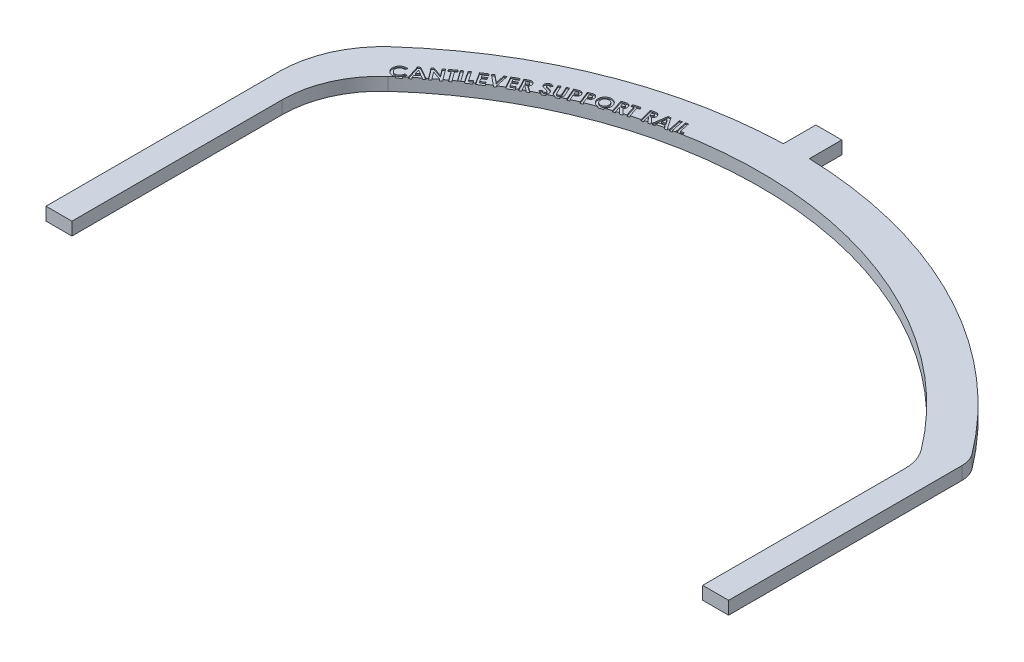
from build123d import *

# Parameters (mm, degrees)
BOSS_EXTRUDE1_DEPTH = 12.7
CUT_EXTRUDE1_DEPTH  = 1.27


with BuildPart() as part:
    # Sketch1 → Boss-Extrude1 (new body)
    with BuildSketch(Plane(origin=(0, 0, 0), x_dir=(1, 0, 0), z_dir=(0, 1, 0))):
        with BuildLine():
            Line((1819.575647687, 435.422089048), (1819.575647687, 467.172089048))
            Line((1819.575647687, 467.172089048), (1844.975647687, 467.172089048))
            Line((1844.975647687, 467.172089048), (1844.975647687, 435.422089048))
            ThreePointArc((1844.975647687, 435.422089048), (2029.473013653, 387.633813525), (2175.09792673, 264.685116838))
            ThreePointArc((2175.09792673, 264.685116838), (2178.788123296, 257.671206838), (2180.062077689, 249.848833516))
            Line((2180.062077689, 249.848833516), (2180.062077689, 21.248833516))
            Line((2180.062077689, 21.248833516), (2154.662077689, 21.248833516))
            Line((2154.662077689, 21.248833516), (2154.662077689, 219.483794294))
            ThreePointArc((2154.662077689, 219.483794294), (2152.61836445, 232.032664182), (2146.698447993, 243.284574615))
            ThreePointArc((2146.698447993, 243.284574615), (1870.010120454, 398.237483297), (1568.838927964, 298.92611779))
            ThreePointArc((1568.838927964, 298.92611779), (1545.192529126, 266.379641947), (1536.828313208, 227.029099893))
            Line((1536.828313208, 227.029099893), (1536.828313208, 21.248833516))
            Line((1536.828313208, 21.248833516), (1511.428313208, 21.248833516))
            Line((1511.428313208, 21.248833516), (1511.428313208, 249.848833516))
            ThreePointArc((1511.428313208, 249.848833516), (1520.212094711, 291.173276452), (1545.044643602, 325.352347784))
            ThreePointArc((1545.044643602, 325.352347784), (1672.530573308, 404.778988418), (1819.575647687, 435.422089048))
        make_face()
    extrude(amount=BOSS_EXTRUDE1_DEPTH)

    # Sketch2 → Cut-Extrude1 (cut)
    # profile 1 of 21: a face of its own
    with BuildSketch(Plane(origin=(0, 12.7, 0), x_dir=(1, 0, 0), z_dir=(0, 1, 0))):
        with BuildLine():
            Line((1571.843475239, 315.241241989), (1571.624685175, 312.938858175))
            add(Edge.make_bspline(
                [(1571.624685175, 312.938858175), (1571.423830346, 312.95320018), (1571.030817247, 312.981263212), (1570.451460835, 312.966511255), (1569.89853054, 312.897766329), (1569.37223433, 312.778767812), (1568.872957947, 312.607797373), (1568.400961983, 312.384647821), (1567.955361244, 312.109537243), (1567.683392705, 311.889488783), (1567.546540143, 311.778762021)],
                knots=[0, 0, 0, 0, 1.106976668, 2.166023744, 3.181239144, 4.166665488, 5.128286044, 6.077510706, 7.032617573, 8, 8, 8, 8], degree=3))
            add(Edge.make_bspline(
                [(1567.546540143, 311.778762021), (1567.437597095, 311.679954033), (1567.222628045, 311.48498373), (1566.941035406, 311.160460329), (1566.697436094, 310.819246434), (1566.489171518, 310.462744752), (1566.324292505, 310.086543291), (1566.195349674, 309.693979337), (1566.107364091, 309.283744628), (1566.056539564, 308.861339139), (1566.046347193, 308.436210992), (1566.076400875, 308.017758642), (1566.147663052, 307.611011022), (1566.260724163, 307.216442504), (1566.413731149, 306.833467742), (1566.608761863, 306.463165076), (1566.843614303, 306.104082164), (1567.027885726, 305.880783175), (1567.121680368, 305.767123399)],
                knots=[0, 0, 0, 0, 1.049434135, 2.070768733, 3.060452324, 4.039838748, 5.013084992, 5.987742953, 6.985396685, 8.003837291, 9.021395483, 10.017099485, 10.994687286, 11.964499222, 12.942743154, 13.934036996, 14.948419371, 16, 16, 16, 16], degree=3))
            add(Edge.make_bspline(
                [(1567.121680368, 305.767123399), (1567.190008672, 305.689640222), (1567.325023071, 305.536536105), (1567.546307933, 305.329608036), (1567.769343702, 305.13573185), (1567.998395719, 304.957570602), (1568.239162335, 304.804651982), (1568.482455302, 304.66206386), (1568.73653994, 304.543714983), (1569.078939899, 304.404505617), (1569.521212625, 304.278677222), (1570.064589098, 304.208210305), (1570.61567632, 304.210675395), (1571.076208289, 304.276072347), (1571.44105165, 304.367936278), (1571.712465721, 304.450339398), (1571.975738465, 304.556973188), (1572.233996588, 304.678316129), (1572.486954395, 304.815768988), (1572.732723891, 304.971963537), (1572.971180863, 305.147724596), (1573.124611751, 305.275343225), (1573.202008893, 305.339719553)],
                knots=[0, 0, 0, 0, 0.906769888, 1.791746381, 2.657716153, 3.502317473, 4.336877027, 5.160868724, 5.977048615, 6.795772978, 8.405980936, 9.998576458, 11.592373078, 13.232275799, 14.068594734, 14.895408789, 15.721048034, 16.560610452, 17.400470113, 18.247563275, 19.115995509, 20, 20, 20, 20], degree=3))
            add(Edge.make_bspline(
                [(1573.202008893, 305.339719553), (1573.327394408, 305.455172782), (1573.573638056, 305.681910489), (1573.896190837, 306.058479393), (1574.166856093, 306.457715982), (1574.355442981, 306.809709288), (1574.480169921, 307.108860132), (1574.567494245, 307.351244823), (1574.642970862, 307.613161328), (1574.708386674, 307.893660828), (1574.766687905, 308.191547501), (1574.817802581, 308.507042123), (1574.85877398, 308.841402876), (1574.876879352, 309.0709405), (1574.886183573, 309.188898239)],
                knots=[0, 0, 0, 0, 1.416413735, 2.781684042, 4.111660732, 5.420779439, 6.093942959, 6.805459672, 7.561959237, 8.35901249, 9.199844318, 10.085547768, 11.016176728, 12, 12, 12, 12], degree=3))
            Line((1574.886183573, 309.188898239), (1577.216552163, 308.977740387))
            add(Edge.make_bspline(
                [(1577.216552163, 308.977740387), (1577.202738534, 308.819844327), (1577.175794321, 308.511859698), (1577.111963056, 308.062705702), (1577.04320757, 307.635185437), (1576.956736694, 307.230134681), (1576.854809766, 306.848313285), (1576.740682876, 306.488998652), (1576.613917814, 306.152387988), (1576.471994882, 305.835978447), (1576.316301242, 305.532760174), (1576.138768716, 305.238961989), (1575.943046876, 304.949738664), (1575.729854522, 304.664662461), (1575.496112608, 304.386262393), (1575.245572176, 304.111361864), (1574.971684774, 303.844456554), (1574.779924283, 303.67185785), (1574.682657932, 303.584310899)],
                knots=[0, 0, 0, 0, 1.238676233, 2.416103621, 3.545066288, 4.62283798, 5.651870757, 6.632945802, 7.568586176, 8.461700084, 9.34220446, 10.231176254, 11.143058229, 12.071059825, 13.012271904, 13.9834215, 14.97713428, 16, 16, 16, 16], degree=3))
            add(Edge.make_bspline(
                [(1574.682657932, 303.584310899), (1574.498657569, 303.431711082), (1574.138593606, 303.133093763), (1573.56444995, 302.749633157), (1572.977890605, 302.431884322), (1572.37665404, 302.181374823), (1571.763450623, 301.993672095), (1571.135717829, 301.873131331), (1570.495330704, 301.821105896), (1569.84754268, 301.830338006), (1569.205957145, 301.907014987), (1568.579314288, 302.043431872), (1567.977191287, 302.24914531), (1567.396796017, 302.515090326), (1566.837706583, 302.843074573), (1566.304134329, 303.236977706), (1565.79056662, 303.691963694), (1565.47770405, 304.034982613), (1565.317934374, 304.210152246)],
                knots=[0, 0, 0, 0, 1.089001882, 2.13103023, 3.141022524, 4.125189271, 5.094826855, 6.059095141, 7.032676967, 8.018451583, 9.007063902, 9.973019583, 10.936218174, 11.901346006, 12.878496912, 13.885081116, 14.919973381, 16, 16, 16, 16], degree=3))
            add(Edge.make_bspline(
                [(1565.317934374, 304.210152246), (1565.219225606, 304.328772834), (1565.024271801, 304.56305329), (1564.75554874, 304.927248485), (1564.518438792, 305.301410187), (1564.313582927, 305.684657582), (1564.129642395, 306.071791752), (1563.981243258, 306.469160166), (1563.857621378, 306.873317043), (1563.763682707, 307.283919991), (1563.700465758, 307.699823901), (1563.664762958, 308.117963515), (1563.656627576, 308.53786684), (1563.679258169, 308.958846411), (1563.735185789, 309.380639705), (1563.8121497, 309.805291307), (1563.922366832, 310.231068134), (1564.062980725, 310.654293086), (1564.226299965, 311.07111694), (1564.414978274, 311.475218067), (1564.629619394, 311.861973795), (1564.866303811, 312.234957115), (1565.128370115, 312.590927953), (1565.414969291, 312.929788063), (1565.722493723, 313.255398592), (1565.945723507, 313.455959724), (1566.058258893, 313.55706731)],
                knots=[0, 0, 0, 0, 1.061484739, 2.096475253, 3.111275369, 4.105800305, 5.08452608, 6.057532138, 7.02088866, 7.990320313, 8.952368766, 9.912611286, 10.875367024, 11.839394567, 12.80975613, 13.800664069, 14.806706453, 15.832448127, 16.867043958, 17.884891479, 18.898046889, 19.907921701, 20.921899798, 21.9362806, 22.95963049, 24, 24, 24, 24], degree=3))
            add(Edge.make_bspline(
                [(1566.058258893, 313.55706731), (1566.156358177, 313.640739803), (1566.351932561, 313.8075524), (1566.664891763, 314.032172309), (1566.98472784, 314.244281066), (1567.315450514, 314.438110352), (1567.657498585, 314.611109041), (1568.010296888, 314.766296078), (1568.372830605, 314.907298962), (1568.746622874, 315.024694527), (1569.125214549, 315.128797988), (1569.509147497, 315.205009785), (1569.893175331, 315.268140341), (1570.279784311, 315.30631184), (1570.667998187, 315.320865497), (1571.058567937, 315.315632115), (1571.451020389, 315.291076997), (1571.712175279, 315.257914823), (1571.843475239, 315.241241989)],
                knots=[0, 0, 0, 0, 0.995486114, 1.984638165, 2.972922349, 3.959272787, 4.943533129, 5.931817313, 6.935373211, 7.946255676, 8.95677732, 9.966470711, 10.967951, 11.961884362, 12.964820168, 13.967071288, 14.97791131, 16, 16, 16, 16], degree=3))
        make_face()
    # profile 2 of 21: a face of its own
    with BuildSketch(Plane(origin=(0, 12.7, 0), x_dir=(1, 0, 0), z_dir=(0, 1, 0))):
        Polygon((1575.292876009, 321.065046146), (1577.190752611, 322.606752877), (1588.949446521, 315.852245665), (1587.00577665, 314.274921947), (1584.596541874, 315.674160729), (1580.589630816, 312.417750473), (1581.431718156, 309.746476434), (1579.488048284, 308.166608646), align=None)
        Polygon((1578.368657259, 319.243491659), (1579.803513028, 314.806632684), (1582.413729374, 316.928387492), align=None, mode=Mode.SUBTRACT)
    # profile 3 of 21: a face of its own
    with BuildSketch(Plane(origin=(0, 12.7, 0), x_dir=(1, 0, 0), z_dir=(0, 1, 0))):
        Polygon((1582.793735528, 327.041800799), (1584.625466297, 328.430863299), (1593.964749149, 325.090498716), (1588.940209887, 331.70762612), (1590.855894983, 333.160290383), (1598.490650592, 323.103579645), (1596.651287611, 321.706884934), (1587.337445463, 325.034529165), (1592.344176233, 318.437754325), (1590.428491137, 316.985090062), align=None)
    # profile 4 of 21: a face of its own
    with BuildSketch(Plane(origin=(0, 12.7, 0), x_dir=(1, 0, 0), z_dir=(0, 1, 0))):
        Polygon((1592.420131061, 334.381377998), (1598.108672727, 338.469699312), (1599.495191157, 336.538749793), (1597.620211189, 335.190392421), (1603.62676167, 326.830576716), (1601.639842599, 325.403353158), (1595.633292118, 333.763168863), (1593.80664949, 332.450428479), align=None)
    # profile 5 of 21: a face of its own
    with BuildSketch(Plane(origin=(0, 12.7, 0), x_dir=(1, 0, 0), z_dir=(0, 1, 0))):
        Polygon((1599.245875898, 339.283355994), (1601.192089841, 340.682594776), (1608.585158751, 330.391829552), (1606.638944809, 328.99259077), align=None)
    # profile 6 of 21: a face of its own
    with BuildSketch(Plane(origin=(0, 12.7, 0), x_dir=(1, 0, 0), z_dir=(0, 1, 0))):
        Polygon((1603.745716433, 342.371184824), (1605.747899927, 343.716998125), (1611.535660343, 335.102775369), (1614.456253292, 337.064253734), (1615.741008901, 335.153656779), (1610.818232459, 331.846365112), align=None)
    # profile 7 of 21: a face of its own
    with BuildSketch(Plane(origin=(0, 12.7, 0), x_dir=(1, 0, 0), z_dir=(0, 1, 0))):
        Polygon((1610.524721329, 346.818657423), (1616.33283431, 350.530456301), (1617.599781425, 348.548625372), (1613.801484149, 346.121582103), (1615.030270207, 344.198264795), (1618.828567483, 346.625308064), (1620.072617963, 344.679094122), (1616.274320688, 342.252050853), (1618.065346329, 339.451029218), (1621.863643605, 341.878072487), (1623.135678861, 339.888609346), (1617.32756588, 336.176810468), align=None)
    # profile 8 of 21: a face of its own
    with BuildSketch(Plane(origin=(0, 12.7, 0), x_dir=(1, 0, 0), z_dir=(0, 1, 0))):
        Polygon((1617.701411816, 351.316695569), (1619.8079022, 352.588730825), (1627.124648995, 346.577092203), (1625.257301239, 355.875669928), (1627.363791623, 357.145161114), (1629.97655204, 344.048286114), (1628.002353322, 342.857661114), align=None)
    # profile 9 of 21: a face of its own
    with BuildSketch(Plane(origin=(0, 12.7, 0), x_dir=(1, 0, 0), z_dir=(0, 1, 0))):
        Polygon((1629.423534241, 358.40580891), (1635.42499658, 361.799598974), (1636.582548664, 359.751622211), (1632.659591933, 357.533192724), (1633.7840711, 355.546273653), (1637.70702783, 357.764703141), (1638.84422735, 355.754887435), (1634.921270619, 353.536457948), (1636.557107959, 350.643849775), (1640.480064689, 352.862279262), (1641.642704914, 350.806670288), (1635.641242574, 347.412880224), align=None)
    # profile 10 of 21: a face of its own
    with BuildSketch(Plane(origin=(0, 12.7, 0), x_dir=(1, 0, 0), z_dir=(0, 1, 0))):
        with BuildLine():
            Line((1637.793764322, 363.052792386), (1640.037634514, 364.251049597))
            add(Edge.make_bspline(
                [(1640.037634514, 364.251049597), (1640.186667462, 364.328633943), (1640.47328419, 364.477842367), (1640.890341997, 364.686498318), (1641.28231965, 364.861277099), (1641.645882783, 365.010273517), (1641.98245437, 365.129482092), (1642.290270996, 365.22671458), (1642.572100657, 365.290475744), (1642.908816123, 365.338899967), (1643.311042174, 365.345296652), (1643.782360817, 365.275248714), (1644.242890429, 365.13028643), (1644.611481026, 364.949625337), (1644.896537931, 364.77252971), (1645.103396517, 364.620392618), (1645.295452221, 364.447335936), (1645.484408767, 364.264865346), (1645.657883573, 364.060235026), (1645.824930181, 363.841738097), (1645.976751463, 363.603553759), (1646.070398227, 363.437390104), (1646.11796304, 363.352992706)],
                knots=[0, 0, 0, 0, 1.424492194, 2.739550529, 3.952795884, 5.062248034, 6.06963158, 6.979329466, 7.797359636, 8.516206473, 9.860824738, 11.190754886, 12.539192688, 13.937924531, 14.658100404, 15.382819568, 16.111238118, 16.848403364, 17.607947602, 18.382986091, 19.178690634, 20, 20, 20, 20], degree=3))
            add(Edge.make_bspline(
                [(1646.11796304, 363.352992706), (1646.164245124, 363.262882078), (1646.255011784, 363.086160546), (1646.366065452, 362.814993718), (1646.45876299, 362.547928155), (1646.529174074, 362.282056374), (1646.570929722, 362.017646443), (1646.594219927, 361.755878358), (1646.598779797, 361.496941252), (1646.573183604, 361.240238507), (1646.532652091, 360.985687952), (1646.460575778, 360.734964919), (1646.373433096, 360.485519449), (1646.259081922, 360.239645992), (1646.12457543, 359.995242302), (1645.966299104, 359.754479723), (1645.787098865, 359.514832541), (1645.652680983, 359.362955422), (1645.583708232, 359.285023956)],
                knots=[0, 0, 0, 0, 1.099424827, 2.156150103, 3.178169677, 4.167481509, 5.137758016, 6.080559922, 7.019758177, 7.944218001, 8.878166263, 9.814109368, 10.772252545, 11.744580148, 12.754248578, 13.798749037, 14.870490064, 16, 16, 16, 16], degree=3))
            Line((1645.583708232, 359.285023956), (1650.849934194, 355.746221873))
            Line((1650.849934194, 355.746221873), (1648.537374097, 354.512347674))
            Line((1648.537374097, 354.512347674), (1643.525555187, 357.885785174))
            Line((1643.525555187, 357.885785174), (1643.327117687, 357.778934213))
            Line((1643.327117687, 357.778934213), (1645.840659354, 353.072403764))
            Line((1645.840659354, 353.072403764), (1643.726536758, 351.942836456))
            Line((1643.726536758, 351.942836456), (1637.793764322, 363.052792386))
        make_face()
        with BuildLine():
            Line((1642.228079226, 359.839631328), (1642.8946257, 360.1958012))
            add(Edge.make_bspline(
                [(1642.8946257, 360.1958012), (1642.975420472, 360.240322147), (1643.129836947, 360.325411412), (1643.347955088, 360.454297268), (1643.538911551, 360.584867186), (1643.707427965, 360.711740321), (1643.853109931, 360.835433203), (1643.974601947, 360.958417813), (1644.071435952, 361.079378737), (1644.167900054, 361.236373908), (1644.243885626, 361.445305905), (1644.252880455, 361.716453691), (1644.195300304, 362.002643575), (1644.10672378, 362.185232425), (1644.059809995, 362.28193902)],
                knots=[0, 0, 0, 0, 1.207273965, 2.307364512, 3.313912315, 4.232827562, 5.067016212, 5.812559251, 6.491981624, 7.089620791, 8.21986244, 9.353205492, 10.598148319, 12, 12, 12, 12], degree=3))
            add(Edge.make_bspline(
                [(1644.059809995, 362.28193902), (1644.025802573, 362.339836412), (1643.959747713, 362.452294337), (1643.835780978, 362.599744003), (1643.693549774, 362.721221809), (1643.535899466, 362.8168612), (1643.367790908, 362.890296416), (1643.189930978, 362.929401316), (1643.006677617, 362.946083103), (1642.848824886, 362.933764874), (1642.712568676, 362.911433447), (1642.596359504, 362.875683478), (1642.464173181, 362.83366135), (1642.31798053, 362.776914621), (1642.158960674, 362.704340321), (1641.982733075, 362.623499015), (1641.792539781, 362.529651065), (1641.662262165, 362.460380793), (1641.594605668, 362.424406969)],
                knots=[0, 0, 0, 0, 1.140030064, 2.21435567, 3.257366816, 4.305744609, 5.339347344, 6.360508158, 7.387757027, 8.457040643, 9.042480678, 9.73163295, 10.520357663, 11.401205891, 12.395136345, 13.49167456, 14.697362465, 16, 16, 16, 16], degree=3))
            Line((1641.594605668, 362.424406969), (1641.012013521, 362.114030367))
            Line((1641.012013521, 362.114030367), (1642.228079226, 359.839631328))
        make_face(mode=Mode.SUBTRACT)
    # profile 11 of 21: a face of its own
    with BuildSketch(Plane(origin=(0, 12.7, 0), x_dir=(1, 0, 0), z_dir=(0, 1, 0))):
        with BuildLine():
            Line((1658.175171156, 371.572727584), (1657.266937983, 369.382282873))
            add(Edge.make_bspline(
                [(1657.266937983, 369.382282873), (1657.153352587, 369.441821201), (1656.934970226, 369.556291205), (1656.606235965, 369.691192766), (1656.293899714, 369.789879794), (1655.998232566, 369.851518312), (1655.718821587, 369.880679324), (1655.456700581, 369.864140419), (1655.210221831, 369.815512586), (1655.059539365, 369.752068126), (1654.984906733, 369.720644251)],
                knots=[0, 0, 0, 0, 1.285296499, 2.471145873, 3.557662113, 4.56489411, 5.495608138, 6.364408464, 7.189895782, 8, 8, 8, 8], degree=3))
            add(Edge.make_bspline(
                [(1654.984906733, 369.720644251), (1654.918234434, 369.685525899), (1654.789568012, 369.617753333), (1654.624123568, 369.482995045), (1654.491978438, 369.328669007), (1654.396213132, 369.1586783), (1654.334419861, 368.985279977), (1654.310516617, 368.816665833), (1654.320311683, 368.654987509), (1654.359700127, 368.558145646), (1654.379417951, 368.509666687)],
                knots=[0, 0, 0, 0, 1.206288137, 2.32793501, 3.399041274, 4.446745914, 5.440434485, 6.332997129, 7.165499693, 8, 8, 8, 8], degree=3))
            add(Edge.make_bspline(
                [(1654.379417951, 368.509666687), (1654.404948204, 368.463631114), (1654.456197837, 368.371218937), (1654.56283673, 368.25166272), (1654.690281046, 368.147332659), (1654.787220204, 368.092704416), (1654.837350643, 368.064454347)],
                knots=[0, 0, 0, 0, 0.970103811, 1.94739414, 2.938529743, 4, 4, 4, 4], degree=3))
            add(Edge.make_bspline(
                [(1654.837350643, 368.064454347), (1654.880457446, 368.045456282), (1654.980065254, 368.001557049), (1655.154004261, 367.935954453), (1655.373142115, 367.862874497), (1655.637165953, 367.782175315), (1655.946256268, 367.69363072), (1656.299508999, 367.593860213), (1656.698307468, 367.487751451), (1656.979401869, 367.415498036), (1657.127014105, 367.377555309)],
                knots=[0, 0, 0, 0, 0.472459698, 1.091722678, 1.863730528, 2.789308553, 3.860756084, 5.088780154, 6.471219384, 8, 8, 8, 8], degree=3))
            add(Edge.make_bspline(
                [(1657.127014105, 367.377555309), (1657.265264183, 367.342874285), (1657.527401208, 367.277115333), (1657.899518678, 367.182333798), (1658.22989405, 367.099451835), (1658.517490864, 367.023462154), (1658.762207737, 366.954233703), (1658.965593665, 366.89531153), (1659.128550351, 366.849132513), (1659.221742663, 366.816509231), (1659.261489265, 366.802595373)],
                knots=[0, 0, 0, 0, 1.547130358, 2.933525647, 4.168111207, 5.244294024, 6.162246243, 6.928465324, 7.542989536, 8, 8, 8, 8], degree=3))
            add(Edge.make_bspline(
                [(1659.261489265, 366.802595373), (1659.416866543, 366.745759691), (1659.715167566, 366.636643722), (1660.128022974, 366.439385384), (1660.49289905, 366.229856242), (1660.808902176, 365.99701465), (1661.085421037, 365.741843236), (1661.329306474, 365.457900876), (1661.547567352, 365.144854733), (1661.666405432, 364.91634032), (1661.726693592, 364.800411879)],
                knots=[0, 0, 0, 0, 1.213962975, 2.330626473, 3.354589457, 4.298409828, 5.205929417, 6.110775893, 7.041571155, 8, 8, 8, 8], degree=3))
            add(Edge.make_bspline(
                [(1661.726693592, 364.800411879), (1661.78019646, 364.685286338), (1661.885173741, 364.459400013), (1661.995575572, 364.107574296), (1662.072560619, 363.758593771), (1662.115795073, 363.409179032), (1662.113761762, 363.060184126), (1662.07887303, 362.711329815), (1662.004047128, 362.363432259), (1661.891747266, 362.019737964), (1661.748465114, 361.684613831), (1661.569408163, 361.367174374), (1661.355974955, 361.071187986), (1661.113838873, 360.792062894), (1660.837292246, 360.534073269), (1660.527140125, 360.298454456), (1660.188474575, 360.076807855), (1659.943718814, 359.951730361), (1659.818640707, 359.887811719)],
                knots=[0, 0, 0, 0, 1.02962662, 2.020216975, 2.985706614, 3.928421304, 4.871563216, 5.812768515, 6.770075055, 7.754113164, 8.743937734, 9.724212038, 10.706152881, 11.701539849, 12.719501034, 13.770110288, 14.860454268, 16, 16, 16, 16], degree=3))
            add(Edge.make_bspline(
                [(1659.818640707, 359.887811719), (1659.718181186, 359.841834401), (1659.520331092, 359.751284332), (1659.218965826, 359.634770983), (1658.916399819, 359.546839825), (1658.615599384, 359.480298389), (1658.315579151, 359.435200527), (1658.015983945, 359.419625414), (1657.716580992, 359.419961272), (1657.418112635, 359.449523978), (1657.118517924, 359.499999027), (1656.817512925, 359.577147244), (1656.514113865, 359.679529639), (1656.20814198, 359.807193433), (1655.900810234, 359.961279398), (1655.588930303, 360.135704683), (1655.278789048, 360.341677582), (1655.074231432, 360.490821914), (1654.96964231, 360.567078546)],
                knots=[0, 0, 0, 0, 1.020655145, 2.01013017, 2.981984048, 3.928688754, 4.855007869, 5.781161295, 6.697887892, 7.618623518, 8.548613333, 9.502552787, 10.48617877, 11.504726676, 12.562913695, 13.661069912, 14.804118609, 16, 16, 16, 16], degree=3))
            Line((1654.96964231, 360.567078546), (1656.249309778, 362.546365405))
            add(Edge.make_bspline(
                [(1656.249309778, 362.546365405), (1656.374046031, 362.459797254), (1656.612973718, 362.293979158), (1656.981491671, 362.097272609), (1657.330168714, 361.941850935), (1657.66753346, 361.844207283), (1657.989314635, 361.792807352), (1658.297696645, 361.795168822), (1658.59229679, 361.845613399), (1658.772492786, 361.922839329), (1658.862070194, 361.961229187)],
                knots=[0, 0, 0, 0, 1.294955125, 2.48043871, 3.560208483, 4.547580911, 5.4699804, 6.331427182, 7.170534129, 8, 8, 8, 8], degree=3))
            add(Edge.make_bspline(
                [(1658.862070194, 361.961229187), (1658.949636597, 362.008304902), (1659.120114389, 362.099953798), (1659.338362831, 362.283837953), (1659.516442306, 362.495494589), (1659.643103156, 362.73424539), (1659.72855637, 362.979870362), (1659.761077029, 363.22316672), (1659.740346293, 363.458967921), (1659.682473523, 363.601486551), (1659.653276124, 363.673388642)],
                knots=[0, 0, 0, 0, 1.141312017, 2.221952111, 3.261367782, 4.304851453, 5.313824071, 6.238453613, 7.111282016, 8, 8, 8, 8], degree=3))
            add(Edge.make_bspline(
                [(1659.653276124, 363.673388642), (1659.618043162, 363.735837903), (1659.546122726, 363.8633145), (1659.395194503, 364.032983282), (1659.205587372, 364.179401013), (1659.02276713, 364.289970191), (1658.850061682, 364.373508127), (1658.688666029, 364.434403633), (1658.502707405, 364.505693653), (1658.286783997, 364.571545666), (1658.043776466, 364.644121626), (1657.772798905, 364.716454382), (1657.474432697, 364.793396975), (1657.266174023, 364.843149872), (1657.157542951, 364.869101783)],
                knots=[0, 0, 0, 0, 0.903379114, 1.844052158, 2.842246005, 3.91819265, 4.535905942, 5.261553176, 6.094840323, 7.049663258, 8.109996595, 9.29687435, 10.590006207, 12, 12, 12, 12], degree=3))
            add(Edge.make_bspline(
                [(1657.157542951, 364.869101783), (1656.950471805, 364.919358087), (1656.552505793, 365.015944702), (1655.981980474, 365.164978348), (1655.464345038, 365.31562461), (1654.996177578, 365.459863896), (1654.579552106, 365.602876619), (1654.216236472, 365.748370856), (1653.902298443, 365.887075558), (1653.635667694, 366.028868992), (1653.402888384, 366.175736438), (1653.19209232, 366.327785106), (1652.998135076, 366.488234441), (1652.821739214, 366.656243853), (1652.663685387, 366.833081224), (1652.519668463, 367.016146047), (1652.394866327, 367.210197392), (1652.323686654, 367.345634721), (1652.288191989, 367.413172296)],
                knots=[0, 0, 0, 0, 1.801846948, 3.46293464, 4.985770843, 6.360246719, 7.605297344, 8.709211276, 9.668866065, 10.506185191, 11.260231506, 11.994654743, 12.702552096, 13.387260004, 14.052463931, 14.706559233, 15.35500904, 16, 16, 16, 16], degree=3))
            add(Edge.make_bspline(
                [(1652.288191989, 367.413172296), (1652.243606084, 367.51067739), (1652.155370413, 367.70364033), (1652.062420447, 368.00541949), (1652.000246113, 368.309630774), (1651.972436215, 368.617579583), (1651.97664765, 368.929100954), (1652.019660918, 369.243224942), (1652.090659725, 369.560299028), (1652.19470327, 369.876354703), (1652.329057061, 370.184232896), (1652.48781523, 370.478370982), (1652.678974477, 370.749317757), (1652.892706732, 371.00131069), (1653.130773845, 371.23538333), (1653.397224235, 371.446811015), (1653.689722605, 371.637959203), (1653.899284745, 371.746640718), (1654.005439586, 371.80169393)],
                knots=[0, 0, 0, 0, 0.98049777, 1.940408708, 2.882708593, 3.818077349, 4.765192484, 5.72798642, 6.714732193, 7.735866685, 8.768355452, 9.78618032, 10.789637419, 11.797438314, 12.807419016, 13.840257857, 14.905970882, 16, 16, 16, 16], degree=3))
            add(Edge.make_bspline(
                [(1654.005439586, 371.80169393), (1654.1481601, 371.865750383), (1654.431664217, 371.992993954), (1654.881881436, 372.115371559), (1655.343472484, 372.18791897), (1655.738885011, 372.201890824), (1656.066180226, 372.186529965), (1656.326809894, 372.151538138), (1656.601848264, 372.100363579), (1656.890630925, 372.031947352), (1657.192401937, 371.943975787), (1657.508472851, 371.839850932), (1657.838279658, 371.715040772), (1658.060992287, 371.620960202), (1658.175171156, 371.572727584)],
                knots=[0, 0, 0, 0, 1.300692523, 2.583732875, 3.869838668, 5.18395136, 5.869692591, 6.595650504, 7.371107987, 8.198227951, 9.065215774, 9.987285263, 10.968134441, 12, 12, 12, 12], degree=3))
        make_face()
    # profile 12 of 21: a face of its own
    with BuildSketch(Plane(origin=(0, 12.7, 0), x_dir=(1, 0, 0), z_dir=(0, 1, 0))):
        with BuildLine():
            Line((1659.919303336, 374.256711197), (1662.107203977, 375.253986838))
            Line((1662.107203977, 375.253986838), (1665.488273688, 367.835477223))
            add(Edge.make_bspline(
                [(1665.488273688, 367.835477223), (1665.523398993, 367.758916516), (1665.590947988, 367.611683666), (1665.696441429, 367.402752311), (1665.796140284, 367.211008784), (1665.899429228, 367.042828951), (1665.991950924, 366.889904573), (1666.086309942, 366.760396959), (1666.178291031, 366.650054725), (1666.295261562, 366.528265131), (1666.452250748, 366.406558016), (1666.658464208, 366.295660194), (1666.879689811, 366.212924465), (1667.118661535, 366.168009539), (1667.3690419, 366.157510971), (1667.628412145, 366.187248555), (1667.894894642, 366.253079049), (1668.067948728, 366.325296668), (1668.157003656, 366.362460396)],
                knots=[0, 0, 0, 0, 1.148606856, 2.208870162, 3.191893431, 4.094332439, 4.899740073, 5.62842557, 6.276993093, 6.857665642, 7.928785062, 8.968990532, 10.041046054, 11.136549395, 12.270861087, 13.445831146, 14.685605594, 16, 16, 16, 16], degree=3))
            add(Edge.make_bspline(
                [(1668.157003656, 366.362460396), (1668.248262813, 366.407542828), (1668.426332623, 366.495510112), (1668.663909354, 366.66437842), (1668.865695223, 366.857822461), (1669.030644236, 367.072061016), (1669.161718556, 367.299026855), (1669.247614582, 367.535458917), (1669.299388176, 367.773446467), (1669.303397823, 367.978701644), (1669.281636044, 368.153291221), (1669.254293344, 368.306801293), (1669.206595506, 368.479477311), (1669.144987941, 368.673619618), (1669.068501972, 368.889082915), (1668.977203142, 369.126268368), (1668.866514481, 369.382046834), (1668.788056093, 369.559566241), (1668.747228015, 369.651943569)],
                knots=[0, 0, 0, 0, 1.2619657, 2.462415837, 3.601481735, 4.719535649, 5.808468573, 6.840936295, 7.829822466, 8.819548695, 9.370564718, 10.01268854, 10.753152273, 11.592117946, 12.540974653, 13.590737845, 14.746271158, 16, 16, 16, 16], degree=3))
            Line((1668.747228015, 369.651943569), (1665.490817759, 376.795693569))
            Line((1665.490817759, 376.795693569), (1667.6787184, 377.79296921))
            Line((1667.6787184, 377.79296921), (1670.792660708, 370.959595813))
            add(Edge.make_bspline(
                [(1670.792660708, 370.959595813), (1670.855012425, 370.820715889), (1670.974784225, 370.553940579), (1671.139957913, 370.167101993), (1671.285996306, 369.811596393), (1671.408757378, 369.484850382), (1671.509719776, 369.188511045), (1671.593781893, 368.9230156), (1671.65184657, 368.687374002), (1671.704689969, 368.412617804), (1671.731886384, 368.081032218), (1671.715736619, 367.677150865), (1671.649975123, 367.259739689), (1671.542399424, 366.835036033), (1671.391004498, 366.419020397), (1671.201690725, 366.024603927), (1670.966449924, 365.663742484), (1670.696362722, 365.329055364), (1670.377818251, 365.02690884), (1670.017400811, 364.748981595), (1669.609872297, 364.495051231), (1669.31432846, 364.352422627), (1669.161911509, 364.278866646)],
                knots=[0, 0, 0, 0, 1.154373368, 2.217442986, 3.189481414, 4.068567181, 4.863699445, 5.5634217, 6.179482907, 6.702893825, 7.683909667, 8.694247001, 9.761044383, 10.882437912, 12.011457245, 13.112964321, 14.192113744, 15.270764901, 16.366852661, 17.512903165, 18.717362128, 20, 20, 20, 20], degree=3))
            add(Edge.make_bspline(
                [(1669.161911509, 364.278866646), (1669.058918069, 364.234455007), (1668.855904579, 364.14691388), (1668.546954197, 364.037242472), (1668.239672433, 363.949255985), (1667.932719368, 363.890616748), (1667.630067091, 363.844251476), (1667.327826752, 363.827406162), (1667.027774391, 363.832891842), (1666.731059447, 363.857890852), (1666.442044797, 363.903428565), (1666.163800068, 363.968197824), (1665.896738293, 364.044977134), (1665.64351042, 364.143786813), (1665.4020961, 364.254221459), (1665.173419047, 364.383006214), (1664.956890341, 364.527828287), (1664.749142072, 364.693607089), (1664.545009922, 364.89056265), (1664.341170397, 365.127253245), (1664.132780409, 365.405618527), (1663.921372648, 365.726886805), (1663.703671322, 366.089062311), (1663.482793364, 366.495483809), (1663.256125966, 366.943382477), (1663.109462491, 367.259210787), (1663.033245644, 367.4233378)],
                knots=[0, 0, 0, 0, 1.019251007, 2.009076554, 2.977879922, 3.921172129, 4.847750704, 5.758907588, 6.668596099, 7.573733929, 8.463345541, 9.325346091, 10.169235366, 10.986622996, 11.793622782, 12.580492856, 13.369361357, 14.159057909, 14.99313892, 15.943772033, 16.995160401, 18.151737694, 19.437977489, 20.835040575, 22.355260374, 24, 24, 24, 24], degree=3))
            Line((1663.033245644, 367.4233378), (1659.919303336, 374.256711197))
        make_face()
    # profile 13 of 21: a face of its own
    with BuildSketch(Plane(origin=(0, 12.7, 0), x_dir=(1, 0, 0), z_dir=(0, 1, 0))):
        with BuildLine():
            Line((1670.535966085, 379.02742207), (1672.873966886, 380.01960957))
            add(Edge.make_bspline(
                [(1672.873966886, 380.01960957), (1673.02723997, 380.082892107), (1673.322441096, 380.204773103), (1673.752041643, 380.372197209), (1674.155811806, 380.509409087), (1674.529772008, 380.62384639), (1674.875622638, 380.715385019), (1675.193578795, 380.778161383), (1675.482887698, 380.822197194), (1675.748724459, 380.834436472), (1675.996952424, 380.826373068), (1676.23717657, 380.802120782), (1676.470512882, 380.75480733), (1676.6999569, 380.694387621), (1676.922771815, 380.61288868), (1677.140706044, 380.512100623), (1677.353995137, 380.396024763), (1677.560557004, 380.260530435), (1677.758395685, 380.107961042), (1677.947853081, 379.93948391), (1678.125625044, 379.753998829), (1678.290946086, 379.551494949), (1678.447645391, 379.33522559), (1678.588743177, 379.099924236), (1678.722083564, 378.85061321), (1678.800153735, 378.675999221), (1678.839812238, 378.587297871)],
                knots=[0, 0, 0, 0, 1.689660618, 3.254255097, 4.697047879, 6.033704492, 7.238788655, 8.34028804, 9.335002176, 10.217429424, 11.047358086, 11.86418334, 12.674216132, 13.470724578, 14.279835096, 15.087929897, 15.915471049, 16.751896755, 17.602221792, 18.459019924, 19.332944929, 20.216936129, 21.12097124, 22.051621646, 23.010252317, 24, 24, 24, 24], degree=3))
            add(Edge.make_bspline(
                [(1678.839812238, 378.587297871), (1678.88030928, 378.487788137), (1678.959948905, 378.292096855), (1679.051799027, 377.99442172), (1679.114649691, 377.700419937), (1679.156828045, 377.412352787), (1679.172200573, 377.127958605), (1679.162194588, 376.847796509), (1679.126573963, 376.571806281), (1679.065189578, 376.302052351), (1678.980434905, 376.039576003), (1678.876615159, 375.784839762), (1678.750673096, 375.539405062), (1678.605896332, 375.302506834), (1678.439793822, 375.075473011), (1678.252507161, 374.857915462), (1678.044698278, 374.649852724), (1677.893474775, 374.520872012), (1677.817095892, 374.455727359)],
                knots=[0, 0, 0, 0, 1.119949485, 2.202441313, 3.243130733, 4.252349037, 5.235347357, 6.208712714, 7.17174001, 8.13281654, 9.089244054, 10.044976356, 10.998086841, 11.962655696, 12.937225365, 13.92802837, 14.95350343, 16, 16, 16, 16], degree=3))
            add(Edge.make_bspline(
                [(1677.817095892, 374.455727359), (1677.765050395, 374.41596107), (1677.652043203, 374.329615912), (1677.456411061, 374.206853426), (1677.228438904, 374.072433719), (1676.96487, 373.929205916), (1676.665338688, 373.780878114), (1676.331975759, 373.623193941), (1675.963769163, 373.457193779), (1675.705692699, 373.346111162), (1675.570681629, 373.287998993)],
                knots=[0, 0, 0, 0, 0.619163102, 1.344398405, 2.182071194, 3.122344939, 4.180426026, 5.342793049, 6.609898992, 8, 8, 8, 8], degree=3))
            Line((1675.570681629, 373.287998993), (1677.651731309, 368.385575115))
            Line((1677.651731309, 368.385575115), (1675.448566245, 367.449357166))
            Line((1675.448566245, 367.449357166), (1670.535966085, 379.02742207))
        make_face()
        with BuildLine():
            Line((1674.659904386, 375.437738577), (1675.359523777, 375.735394827))
            add(Edge.make_bspline(
                [(1675.359523777, 375.735394827), (1675.486429277, 375.791015122), (1675.719639327, 375.893226704), (1676.030631421, 376.049436294), (1676.27299029, 376.192729989), (1676.453645965, 376.329237522), (1676.585912389, 376.4679079), (1676.68327855, 376.616200071), (1676.758792164, 376.773990218), (1676.803948418, 376.944793538), (1676.824636521, 377.123080268), (1676.816894365, 377.30772645), (1676.778197001, 377.496765721), (1676.730162171, 377.618628386), (1676.705337078, 377.681608769)],
                knots=[0, 0, 0, 0, 1.834712417, 3.371590487, 4.606164242, 5.558628623, 6.361029854, 7.130371054, 7.899056239, 8.66733113, 9.458573617, 10.267861196, 11.104805679, 12, 12, 12, 12], degree=3))
            add(Edge.make_bspline(
                [(1676.705337078, 377.681608769), (1676.681195521, 377.734866929), (1676.634203899, 377.838534114), (1676.543955826, 377.978716943), (1676.4444553, 378.101842228), (1676.334982909, 378.208612417), (1676.209746175, 378.292614671), (1676.075561454, 378.362194684), (1675.927747362, 378.411293604), (1675.824547482, 378.428420907), (1675.7716632, 378.437197711)],
                knots=[0, 0, 0, 0, 1.110257439, 2.16111975, 3.158055274, 4.115775599, 5.054727361, 6.013532307, 6.982044188, 8, 8, 8, 8], degree=3))
            add(Edge.make_bspline(
                [(1675.7716632, 378.437197711), (1675.729298222, 378.441799663), (1675.638724346, 378.451638371), (1675.493609475, 378.44088052), (1675.332196003, 378.417716273), (1675.153875395, 378.378683482), (1674.957935571, 378.324624501), (1674.743704532, 378.25594769), (1674.513246772, 378.169107123), (1674.355247017, 378.102758829), (1674.273205668, 378.068307487)],
                knots=[0, 0, 0, 0, 0.655061824, 1.400484349, 2.231586647, 3.166505476, 4.208814957, 5.36109033, 6.629746539, 8, 8, 8, 8], degree=3))
            Line((1674.273205668, 378.068307487), (1673.652452463, 377.806268224))
            Line((1673.652452463, 377.806268224), (1674.659904386, 375.437738577))
        make_face(mode=Mode.SUBTRACT)
    # profile 14 of 21: a face of its own
    with BuildSketch(Plane(origin=(0, 12.7, 0), x_dir=(1, 0, 0), z_dir=(0, 1, 0))):
        with BuildLine():
            Line((1680.001967933, 382.985977015), (1682.362865369, 383.914562752))
            add(Edge.make_bspline(
                [(1682.362865369, 383.914562752), (1682.517765791, 383.973858504), (1682.816197002, 384.08809772), (1683.251505403, 384.240393631), (1683.656946316, 384.372483529), (1684.03401535, 384.476295115), (1684.382840661, 384.556338354), (1684.701915324, 384.61375853), (1684.992691391, 384.644524743), (1685.258241868, 384.654497658), (1685.505491627, 384.636649569), (1685.744883116, 384.607809227), (1685.977812998, 384.556226977), (1686.205114837, 384.487804215), (1686.425092423, 384.400164285), (1686.64028815, 384.29618323), (1686.847774296, 384.170002628), (1687.052233616, 384.030865565), (1687.247231091, 383.873694687), (1687.43091443, 383.700139773), (1687.602749708, 383.510438118), (1687.76140234, 383.304100879), (1687.913566828, 383.084891816), (1688.050726635, 382.84724915), (1688.174533102, 382.593088132), (1688.248172365, 382.416488548), (1688.285461523, 382.327062752)],
                knots=[0, 0, 0, 0, 1.690971706, 3.257826704, 4.701545407, 6.03769772, 7.243728968, 8.349619834, 9.340721722, 10.22300603, 11.054651896, 11.865406004, 12.67942679, 13.483561252, 14.283127526, 15.091295784, 15.917214025, 16.756599211, 17.611340278, 18.467610516, 19.330706852, 20.217933968, 21.119661199, 22.049469544, 23.012298128, 24, 24, 24, 24], degree=3))
            add(Edge.make_bspline(
                [(1688.285461523, 382.327062752), (1688.323826751, 382.226770196), (1688.399262925, 382.029568537), (1688.477829568, 381.728789541), (1688.538919752, 381.434429281), (1688.571587346, 381.144936156), (1688.580036913, 380.859728788), (1688.561292302, 380.580669649), (1688.522018711, 380.305008308), (1688.451637842, 380.037749116), (1688.363367897, 379.775809466), (1688.249840642, 379.525320351), (1688.122100037, 379.281253728), (1687.965058339, 379.052731453), (1687.797564683, 378.82680675), (1687.601644484, 378.61734488), (1687.389939328, 378.413263887), (1687.234957243, 378.289273775), (1687.155894215, 378.226021085)],
                knots=[0, 0, 0, 0, 1.119200622, 2.20064409, 3.237997615, 4.252896345, 5.235082516, 6.210032964, 7.167002221, 8.134541552, 9.088398972, 10.046675453, 11.000409829, 11.957174671, 12.935489789, 13.930929299, 14.944478044, 16, 16, 16, 16], degree=3))
            add(Edge.make_bspline(
                [(1687.155894215, 378.226021085), (1687.1029326, 378.188011497), (1686.987796798, 378.105380625), (1686.790434788, 377.98740531), (1686.558652713, 377.860391449), (1686.291135025, 377.72594814), (1685.988592321, 377.584694874), (1685.652107144, 377.432850481), (1685.277938469, 377.280280056), (1685.017190563, 377.174433726), (1684.881495177, 377.119350412)],
                knots=[0, 0, 0, 0, 0.616935112, 1.341184906, 2.174787505, 3.119073227, 4.174954117, 5.335746697, 6.613500353, 8, 8, 8, 8], degree=3))
            Line((1684.881495177, 377.119350412), (1686.83279726, 372.166045124))
            Line((1686.83279726, 372.166045124), (1684.606735561, 371.290884867))
            Line((1684.606735561, 371.290884867), (1680.001967933, 382.985977015))
        make_face()
        with BuildLine():
            Line((1684.026687485, 379.28944256), (1684.733939087, 379.569290316))
            add(Edge.make_bspline(
                [(1684.733939087, 379.569290316), (1684.861552227, 379.621732726), (1685.095832423, 379.718009789), (1685.411219847, 379.863572231), (1685.656210104, 380.001317443), (1685.840995432, 380.132628303), (1685.976137201, 380.269496505), (1686.076326811, 380.415832898), (1686.159760818, 380.570381615), (1686.208346688, 380.739458487), (1686.234907317, 380.916655996), (1686.232120186, 381.10054455), (1686.198349001, 381.290366271), (1686.153770185, 381.413458425), (1686.130633799, 381.477343201)],
                knots=[0, 0, 0, 0, 1.829445723, 3.358611067, 4.602722299, 5.551823925, 6.354940194, 7.137967404, 7.89738525, 8.672867184, 9.456862689, 10.266564559, 11.100347739, 12, 12, 12, 12], degree=3))
            add(Edge.make_bspline(
                [(1686.130633799, 381.477343201), (1686.108100685, 381.531328476), (1686.064322869, 381.636212226), (1685.980545784, 381.779798964), (1685.881579287, 381.902545665), (1685.774958875, 382.012619534), (1685.65199751, 382.09961512), (1685.520374183, 382.174529995), (1685.37393601, 382.223728096), (1685.271819419, 382.245002913), (1685.219856555, 382.255828778)],
                knots=[0, 0, 0, 0, 1.113901604, 2.164111918, 3.153263189, 4.112944882, 5.072762576, 6.012793755, 6.988793837, 8, 8, 8, 8], degree=3))
            add(Edge.make_bspline(
                [(1685.219856555, 382.255828778), (1685.177517884, 382.261108177), (1685.087145274, 382.272377144), (1684.942004782, 382.267705314), (1684.779714507, 382.249057554), (1684.600372482, 382.215835412), (1684.402869822, 382.166051539), (1684.187984543, 382.102900632), (1683.955659391, 382.023321637), (1683.796670864, 381.962107609), (1683.713766811, 381.930187752)],
                knots=[0, 0, 0, 0, 0.657259141, 1.402930778, 2.232038404, 3.176153203, 4.213517427, 5.372403576, 6.629848365, 8, 8, 8, 8], degree=3))
            Line((1683.713766811, 381.930187752), (1683.085381395, 381.683412912))
            Line((1683.085381395, 381.683412912), (1684.026687485, 379.28944256))
        make_face(mode=Mode.SUBTRACT)
    # profile 15 of 21: a face of its own
    with BuildSketch(Plane(origin=(0, 12.7, 0), x_dir=(1, 0, 0), z_dir=(0, 1, 0))):
        with BuildLine():
            add(Edge.make_bspline(
                [(1694.986511615, 389.086633824), (1695.195649407, 389.155276897), (1695.608930665, 389.290923807), (1696.242763148, 389.41935216), (1696.874231299, 389.484403624), (1697.504534427, 389.481934168), (1698.13255712, 389.411813886), (1698.759333657, 389.279449061), (1699.382762007, 389.07771707), (1699.997861849, 388.818297442), (1700.589115537, 388.503897225), (1701.138128373, 388.137525144), (1701.64399933, 387.731090144), (1702.094561051, 387.27107776), (1702.503426528, 386.770700596), (1702.858150484, 386.22063641), (1703.170623749, 385.62816511), (1703.332704299, 385.207075535), (1703.415017224, 384.993224369)],
                knots=[0, 0, 0, 0, 1.013359816, 2.00252003, 2.972428751, 3.933508404, 4.900351514, 5.878838085, 6.879618506, 7.914329461, 8.950779576, 9.959565335, 10.951068183, 11.934541408, 12.920548813, 13.922891258, 14.945136255, 16, 16, 16, 16], degree=3))
            add(Edge.make_bspline(
                [(1703.415017224, 384.993224369), (1703.48635799, 384.777344189), (1703.626530988, 384.353174759), (1703.759626281, 383.703867671), (1703.833303778, 383.061772592), (1703.837469858, 382.42320603), (1703.779580681, 381.789712197), (1703.653814435, 381.160512823), (1703.460629589, 380.537558657), (1703.208575277, 379.926499779), (1702.899842753, 379.342874481), (1702.545928248, 378.798657468), (1702.148549798, 378.301051802), (1701.70077535, 377.857133191), (1701.215085819, 377.454903378), (1700.681087073, 377.10538436), (1700.104091497, 376.802587655), (1699.694739973, 376.643115348), (1699.486972352, 376.56217469)],
                knots=[0, 0, 0, 0, 1.053062635, 2.069096744, 3.065709656, 4.044466716, 5.023444743, 6.009373548, 7.012730404, 8.041953741, 9.068780011, 10.068504032, 11.047000603, 12.014221783, 12.986048311, 13.965026338, 14.967142878, 16, 16, 16, 16], degree=3))
            add(Edge.make_bspline(
                [(1699.486972352, 376.56217469), (1699.26605364, 376.488941455), (1698.832002832, 376.345056202), (1698.168040593, 376.20999449), (1697.513108366, 376.135108137), (1696.864872709, 376.136909904), (1696.225027467, 376.201785799), (1695.593068531, 376.339685988), (1694.966826407, 376.539531511), (1694.3593887, 376.813294713), (1693.77726747, 377.135631168), (1693.23642589, 377.505338463), (1692.741601011, 377.916149284), (1692.297681122, 378.372122223), (1691.898423044, 378.867029852), (1691.549526673, 379.404548939), (1691.244908557, 379.981910835), (1691.087448084, 380.391748205), (1691.007585333, 380.599614594)],
                knots=[0, 0, 0, 0, 1.066870694, 2.096137914, 3.101873705, 4.086131695, 5.063964246, 6.046752648, 7.048213106, 8.074041091, 9.098052757, 10.097266453, 11.075052569, 12.043428826, 13.011898852, 13.98735265, 14.979200614, 16, 16, 16, 16], degree=3))
            add(Edge.make_bspline(
                [(1691.007585333, 380.599614594), (1690.958832908, 380.741443478), (1690.861986984, 381.02318432), (1690.754938396, 381.454197383), (1690.67168881, 381.884524413), (1690.621572442, 382.31571566), (1690.598530196, 382.746495218), (1690.602860718, 383.178343638), (1690.639550983, 383.610817605), (1690.702597145, 384.042586463), (1690.794072403, 384.468224959), (1690.91104293, 384.883854864), (1691.054415251, 385.288493759), (1691.223888561, 385.681447964), (1691.421595795, 386.062331822), (1691.64267929, 386.431537156), (1691.890721441, 386.789438088), (1692.164312497, 387.132886562), (1692.457458481, 387.459942206), (1692.769399426, 387.764164987), (1693.098101825, 388.044972577), (1693.444433495, 388.300572272), (1693.80368827, 388.537355018), (1694.182300887, 388.745118729), (1694.575706053, 388.932696249), (1694.849164075, 389.035166782), (1694.986511615, 389.086633824)],
                knots=[0, 0, 0, 0, 1.035508431, 2.057021171, 3.064582206, 4.061460992, 5.052834358, 6.042874244, 7.042073774, 8.048612597, 9.055066188, 10.047183446, 11.029132005, 12.018287686, 13.000760277, 13.991302594, 14.989007151, 16.006312308, 17.022554405, 18.020877843, 19.013963055, 20.006287811, 20.992507816, 21.983638865, 22.987258668, 24, 24, 24, 24], degree=3))
        make_face()
        with BuildLine():
            add(Edge.make_bspline(
                [(1695.75736498, 386.852939914), (1695.622998409, 386.801421684), (1695.358888347, 386.700157784), (1694.989198795, 386.503101152), (1694.644703735, 386.283145173), (1694.334362798, 386.026592444), (1694.050844449, 385.742206963), (1693.79992482, 385.424988289), (1693.573944209, 385.080264529), (1693.383099035, 384.707889564), (1693.224546395, 384.318633101), (1693.110754327, 383.917399723), (1693.034797542, 383.509504024), (1693.005909207, 383.094120698), (1693.015169081, 382.672239573), (1693.070581185, 382.243897909), (1693.166440789, 381.808563328), (1693.261587048, 381.521518883), (1693.309969147, 381.3755561)],
                knots=[0, 0, 0, 0, 1.028897145, 2.022393561, 2.991951308, 3.949257574, 4.897616044, 5.860541783, 6.838495763, 7.842758106, 8.850224137, 9.841363853, 10.822194479, 11.814058501, 12.815676981, 13.837119878, 14.900170312, 16, 16, 16, 16], degree=3))
            add(Edge.make_bspline(
                [(1693.309969147, 381.3755561), (1693.370895515, 381.216240997), (1693.490290886, 380.904036503), (1693.725784294, 380.471329693), (1693.988085997, 380.075601755), (1694.293267, 379.728004886), (1694.626728325, 379.415411524), (1695.002037425, 379.152213803), (1695.408031967, 378.92325825), (1695.700583309, 378.8117269), (1695.848951518, 378.755163472)],
                knots=[0, 0, 0, 0, 1.081747061, 2.119863636, 3.120316099, 4.089691728, 5.049783635, 6.01484398, 6.993222716, 8, 8, 8, 8], degree=3))
            add(Edge.make_bspline(
                [(1695.848951518, 378.755163472), (1695.967101031, 378.716662294), (1696.200928478, 378.640465349), (1696.558761966, 378.562714593), (1696.915932021, 378.512970255), (1697.273715002, 378.497658556), (1697.632069721, 378.516334475), (1697.990201306, 378.564948985), (1698.349303116, 378.642537218), (1698.582769416, 378.720711677), (1698.700854563, 378.760251613)],
                knots=[0, 0, 0, 0, 1.024293903, 2.027160531, 3.015286266, 3.99533478, 4.975707661, 5.970764235, 6.973630863, 8, 8, 8, 8], degree=3))
            add(Edge.make_bspline(
                [(1698.700854563, 378.760251613), (1698.831742451, 378.811094933), (1699.089663132, 378.911284065), (1699.452290881, 379.10438305), (1699.788445541, 379.326974533), (1700.097076779, 379.580414993), (1700.373242776, 379.869576887), (1700.623856761, 380.185774676), (1700.846227533, 380.534400499), (1701.037410021, 380.910312759), (1701.193853015, 381.303872483), (1701.312398405, 381.705710994), (1701.388741492, 382.111424317), (1701.425318461, 382.521286416), (1701.417673253, 382.935862415), (1701.363844928, 383.354237726), (1701.277870551, 383.778774157), (1701.185144678, 384.056133827), (1701.138074115, 384.196930299)],
                knots=[0, 0, 0, 0, 1.01498529, 2.00007581, 2.964728426, 3.92764365, 4.882061039, 5.851577318, 6.841925145, 7.867953729, 8.897697997, 9.901256077, 10.893805186, 11.87902939, 12.87294236, 13.886406516, 14.927073624, 16, 16, 16, 16], degree=3))
            add(Edge.make_bspline(
                [(1701.138074115, 384.196930299), (1701.084551529, 384.335362958), (1700.979439936, 384.607227201), (1700.781702615, 384.992082284), (1700.552353118, 385.345876345), (1700.293814767, 385.671835731), (1700.005602641, 385.967478702), (1699.6872218, 386.234777291), (1699.33808638, 386.47083632), (1698.963723887, 386.6752065), (1698.574613583, 386.844581519), (1698.179078582, 386.976446336), (1697.779781986, 387.062368096), (1697.378448211, 387.110643117), (1696.974067388, 387.108428547), (1696.568274327, 387.06842654), (1696.160024391, 386.983703529), (1695.893172647, 386.897043444), (1695.75736498, 386.852939914)],
                knots=[0, 0, 0, 0, 1.065513698, 2.092534206, 3.101182988, 4.089562544, 5.075969379, 6.061755399, 7.070349004, 8.098019571, 9.120985987, 10.114905663, 11.087429554, 12.05000257, 13.012402119, 13.98578401, 14.974914045, 16, 16, 16, 16], degree=3))
        make_face(mode=Mode.SUBTRACT)
    # profile 16 of 21: a face of its own
    with BuildSketch(Plane(origin=(0, 12.7, 0), x_dir=(1, 0, 0), z_dir=(0, 1, 0))):
        with BuildLine():
            Line((1703.95303641, 391.894677585), (1706.38516782, 392.680795373))
            add(Edge.make_bspline(
                [(1706.38516782, 392.680795373), (1706.546033304, 392.731675521), (1706.85561697, 392.829593746), (1707.306827713, 392.957406787), (1707.725170049, 393.061492261), (1708.110970333, 393.144788634), (1708.46515399, 393.202803927), (1708.786634173, 393.243491133), (1709.076722199, 393.256879495), (1709.338958958, 393.247562616), (1709.581721135, 393.214865798), (1709.815469422, 393.170632327), (1710.042200975, 393.103178435), (1710.264231223, 393.019174771), (1710.480444899, 392.917424598), (1710.691052881, 392.797253492), (1710.893141139, 392.655898338), (1711.0927444, 392.502460792), (1711.279199989, 392.328208134), (1711.4588959, 392.143885122), (1711.621648142, 391.941018655), (1711.772251629, 391.724321288), (1711.909499709, 391.491982497), (1712.034863854, 391.245218266), (1712.143234424, 390.982231316), (1712.206826977, 390.801027308), (1712.23907407, 390.709140726)],
                knots=[0, 0, 0, 0, 1.707862225, 3.286760069, 4.746257889, 6.071288484, 7.280743464, 8.37853897, 9.349524202, 10.217227301, 11.030708687, 11.827023673, 12.622968409, 13.421731966, 14.228162213, 15.039511986, 15.872905528, 16.722933565, 17.585654106, 18.45386662, 19.326650486, 20.214875647, 21.123240435, 22.056138947, 23.014289192, 24, 24, 24, 24], degree=3))
            add(Edge.make_bspline(
                [(1712.23907407, 390.709140726), (1712.268273615, 390.611952078), (1712.325718755, 390.420749939), (1712.389526882, 390.133540106), (1712.430015483, 389.852010268), (1712.451771185, 389.577405855), (1712.448216007, 389.308595035), (1712.426841045, 389.046231449), (1712.379446849, 388.790441359), (1712.314681378, 388.540341662), (1712.223623659, 388.297796105), (1712.115165551, 388.060203705), (1711.98112184, 387.830179123), (1711.825352087, 387.605686014), (1711.647058387, 387.387611444), (1711.447927524, 387.175288128), (1711.225609622, 386.971840046), (1711.066143786, 386.843818041), (1710.984847307, 386.778551783)],
                knots=[0, 0, 0, 0, 1.095842841, 2.155884457, 3.174022624, 4.165949705, 5.127731965, 6.074746448, 7.005407987, 7.934084208, 8.861404367, 9.79987579, 10.751926445, 11.732668498, 12.748331648, 13.791580649, 14.874136787, 16, 16, 16, 16], degree=3))
            Line((1710.984847307, 386.778551783), (1715.56417423, 382.344236879))
            Line((1715.56417423, 382.344236879), (1713.058264775, 381.535222456))
            Line((1713.058264775, 381.535222456), (1708.700271987, 385.760923578))
            Line((1708.700271987, 385.760923578), (1708.486570063, 385.689689604))
            Line((1708.486570063, 385.689689604), (1710.135127756, 380.588828226))
            Line((1710.135127756, 380.588828226), (1707.842920224, 379.848503706))
            Line((1707.842920224, 379.848503706), (1703.95303641, 391.894677585))
        make_face()
        with BuildLine():
            Line((1707.764054038, 387.925927585), (1708.484025993, 388.159982072))
            add(Edge.make_bspline(
                [(1708.484025993, 388.159982072), (1708.571603368, 388.188995846), (1708.740215947, 388.244856019), (1708.979029024, 388.335865502), (1709.193773209, 388.430259954), (1709.383702599, 388.525365694), (1709.549118832, 388.623653152), (1709.691911338, 388.721124493), (1709.810498227, 388.822845732), (1709.904698014, 388.929125428), (1709.977005629, 389.041240078), (1710.033689564, 389.158031606), (1710.072138483, 389.283343672), (1710.095254213, 389.415774239), (1710.099960426, 389.556967393), (1710.085982462, 389.704301269), (1710.058286115, 389.859629725), (1710.026858147, 389.963161299), (1710.010468301, 390.017153546)],
                knots=[0, 0, 0, 0, 1.59741655, 3.075503518, 4.423340449, 5.657954991, 6.75092257, 7.753009773, 8.648148301, 9.449349913, 10.202840492, 10.951594347, 11.690054068, 12.46498857, 13.273157284, 14.12800387, 15.023744414, 16, 16, 16, 16], degree=3))
            add(Edge.make_bspline(
                [(1710.010468301, 390.017153546), (1709.987864808, 390.079957996), (1709.943594945, 390.202963081), (1709.844458112, 390.369266003), (1709.727539744, 390.516321987), (1709.588375498, 390.639360785), (1709.433403912, 390.737832409), (1709.266726925, 390.813448891), (1709.087648326, 390.859015654), (1708.929676716, 390.875726609), (1708.790797512, 390.876005747), (1708.669262089, 390.864902934), (1708.531668229, 390.844471473), (1708.377821378, 390.811874625), (1708.205500957, 390.776036663), (1708.018180465, 390.722798195), (1707.813308503, 390.665125271), (1707.672345659, 390.620512686), (1707.598689454, 390.597201623)],
                knots=[0, 0, 0, 0, 1.127951054, 2.209138267, 3.260936738, 4.29842436, 5.338095959, 6.360165074, 7.384149028, 8.452964063, 9.041714888, 9.733373303, 10.51726453, 11.395913881, 12.395853473, 13.496603147, 14.691919753, 16, 16, 16, 16], degree=3))
            Line((1707.598689454, 390.597201623), (1706.967759967, 390.391131912))
            Line((1706.967759967, 390.391131912), (1707.764054038, 387.925927585))
        make_face(mode=Mode.SUBTRACT)
    # profile 17 of 21: a face of its own
    with BuildSketch(Plane(origin=(0, 12.7, 0), x_dir=(1, 0, 0), z_dir=(0, 1, 0))):
        Polygon((1712.669706372, 394.611949569), (1719.327538904, 396.596324569), (1720.00171759, 394.334645883), (1717.806184737, 393.680819761), (1720.721689545, 383.896324569), (1718.396409096, 383.201793319), (1715.480904289, 392.986288511), (1713.343885058, 392.350270883), align=None)
    # profile 18 of 21: a face of its own
    with BuildSketch(Plane(origin=(0, 12.7, 0), x_dir=(1, 0, 0), z_dir=(0, 1, 0))):
        with BuildLine():
            Line((1726.172454889, 398.49792486), (1728.627482934, 399.139030629))
            add(Edge.make_bspline(
                [(1728.627482934, 399.139030629), (1728.79017942, 399.179379458), (1729.103037042, 399.256968341), (1729.556874395, 399.361149269), (1729.978103255, 399.439083179), (1730.365733035, 399.498990671), (1730.719667156, 399.537468936), (1731.040732201, 399.557714417), (1731.328868774, 399.551857401), (1731.588760633, 399.531104216), (1731.827010003, 399.484758471), (1732.055917722, 399.427862487), (1732.276057479, 399.347337386), (1732.492494648, 399.253928848), (1732.699482956, 399.138159711), (1732.902937407, 399.009127144), (1733.095059986, 398.85684182), (1733.283427045, 398.692859797), (1733.46171442, 398.512924284), (1733.62507717, 398.315617027), (1733.773596054, 398.104393374), (1733.914219659, 397.882145951), (1734.033358179, 397.642773093), (1734.144965965, 397.392552272), (1734.238776596, 397.126760266), (1734.289958669, 396.942968415), (1734.316024601, 396.849367168)],
                knots=[0, 0, 0, 0, 1.709197672, 3.286706037, 4.746884141, 6.076154564, 7.285033642, 8.3762067, 9.353444754, 10.221616647, 11.030586576, 11.82543125, 12.624029638, 13.417697636, 14.226482699, 15.039555006, 15.871489336, 16.723141328, 17.585263771, 18.451020956, 19.331549202, 20.216946376, 21.129580093, 22.054946105, 23.009425771, 24, 24, 24, 24], degree=3))
            add(Edge.make_bspline(
                [(1734.316024601, 396.849367168), (1734.340483649, 396.75132296), (1734.388644262, 396.558270925), (1734.432756045, 396.268706525), (1734.45905287, 395.987515586), (1734.465126912, 395.71359502), (1734.44701867, 395.44727305), (1734.408333438, 395.187910967), (1734.351219226, 394.936144156), (1734.268429541, 394.693150994), (1734.165571077, 394.457887009), (1734.044753887, 394.228274876), (1733.897702716, 394.009287871), (1733.731317116, 393.796436273), (1733.542728778, 393.591297004), (1733.334167343, 393.39160859), (1733.100811855, 393.203752921), (1732.935210366, 393.085843759), (1732.850639985, 393.025629187)],
                knots=[0, 0, 0, 0, 1.098517095, 2.163013655, 3.181774078, 4.168852777, 5.13946199, 6.081245344, 7.018682818, 7.943282145, 8.868571282, 9.809360479, 10.760983594, 11.733344178, 12.745276063, 13.789113357, 14.870930896, 16, 16, 16, 16], degree=3))
            Line((1732.850639985, 393.025629187), (1737.1373988, 388.367436078))
            Line((1737.1373988, 388.367436078), (1734.606048639, 387.708521815))
            Line((1734.606048639, 387.708521815), (1730.527903607, 392.14538079))
            Line((1730.527903607, 392.14538079), (1730.314201684, 392.089411238))
            Line((1730.314201684, 392.089411238), (1731.654926844, 386.93766845))
            Line((1731.654926844, 386.93766845), (1729.339822678, 386.334723738))
            Line((1729.339822678, 386.334723738), (1726.172454889, 398.49792486))
        make_face()
        with BuildLine():
            Line((1729.726521396, 394.346001783), (1730.454125562, 394.536807072))
            add(Edge.make_bspline(
                [(1730.454125562, 394.536807072), (1730.542466909, 394.560867506), (1730.712322945, 394.607129083), (1730.954151042, 394.682116225), (1731.170977283, 394.764321569), (1731.364233971, 394.847239506), (1731.534330302, 394.933384597), (1731.679240107, 395.025373044), (1731.803760032, 395.118054261), (1731.931495502, 395.250327424), (1732.054978096, 395.43570562), (1732.127223925, 395.696987696), (1732.136610976, 395.988871577), (1732.094563981, 396.186752264), (1732.072154409, 396.292215726)],
                knots=[0, 0, 0, 0, 1.199402354, 2.306119801, 3.315075623, 4.235507751, 5.060264928, 5.809190125, 6.482448808, 7.087349174, 8.212040722, 9.358036786, 10.591926322, 12, 12, 12, 12], degree=3))
            add(Edge.make_bspline(
                [(1732.072154409, 396.292215726), (1732.052827377, 396.355685255), (1732.014909608, 396.48020634), (1731.927528828, 396.650788371), (1731.818763576, 396.802919825), (1731.686382131, 396.930792015), (1731.538652913, 397.038868936), (1731.376894824, 397.120624514), (1731.202943925, 397.177833604), (1731.046922074, 397.20318023), (1730.90957095, 397.209357366), (1730.788794837, 397.206981215), (1730.651442568, 397.192595874), (1730.49672467, 397.173284861), (1730.325718848, 397.141148618), (1730.137449149, 397.102990515), (1729.930994392, 397.057730728), (1729.788316172, 397.021127697), (1729.713801043, 397.002011399)],
                knots=[0, 0, 0, 0, 1.130450346, 2.217834378, 3.254228609, 4.308357394, 5.344751624, 6.367412783, 7.388023697, 8.458713588, 9.052801795, 9.733174865, 10.51804624, 11.408443717, 12.393547821, 13.486312122, 14.687201355, 16, 16, 16, 16], degree=3))
            Line((1729.713801043, 397.002011399), (1729.077783415, 396.834102745))
            Line((1729.077783415, 396.834102745), (1729.726521396, 394.346001783))
        make_face(mode=Mode.SUBTRACT)
    # profile 19 of 21: a face of its own
    with BuildSketch(Plane(origin=(0, 12.7, 0), x_dir=(1, 0, 0), z_dir=(0, 1, 0))):
        Polygon((1740.047897262, 401.984076955), (1742.41897098, 402.525963975), (1749.954507839, 391.326965577), (1747.524920499, 390.769814135), (1745.985757839, 393.07983016), (1740.976482999, 391.932454359), (1740.556711365, 389.174681923), (1738.127124025, 388.620074551), align=None)
        Polygon((1741.996655275, 399.002426314), (1741.325020659, 394.412923109), (1744.589063127, 395.158335769), align=None, mode=Mode.SUBTRACT)
    # profile 20 of 21: a face of its own
    with BuildSketch(Plane(origin=(0, 12.7, 0), x_dir=(1, 0, 0), z_dir=(0, 1, 0))):
        Polygon((1749.111067464, 404.098849364), (1751.454156406, 404.579678691), (1754.00077099, 392.182423082), (1751.657682047, 391.701593755), align=None)
    # profile 21 of 21: a face of its own
    with BuildSketch(Plane(origin=(0, 12.7, 0), x_dir=(1, 0, 0), z_dir=(0, 1, 0))):
        Polygon((1754.065942971, 405.118025628), (1756.424296337, 405.603943096), (1758.507890087, 395.455645821), (1761.94747342, 396.160353353), (1762.410494253, 393.911395019), (1756.612557554, 392.720770019), align=None)
    extrude(amount=-CUT_EXTRUDE1_DEPTH, mode=Mode.SUBTRACT)


solid = part.part
